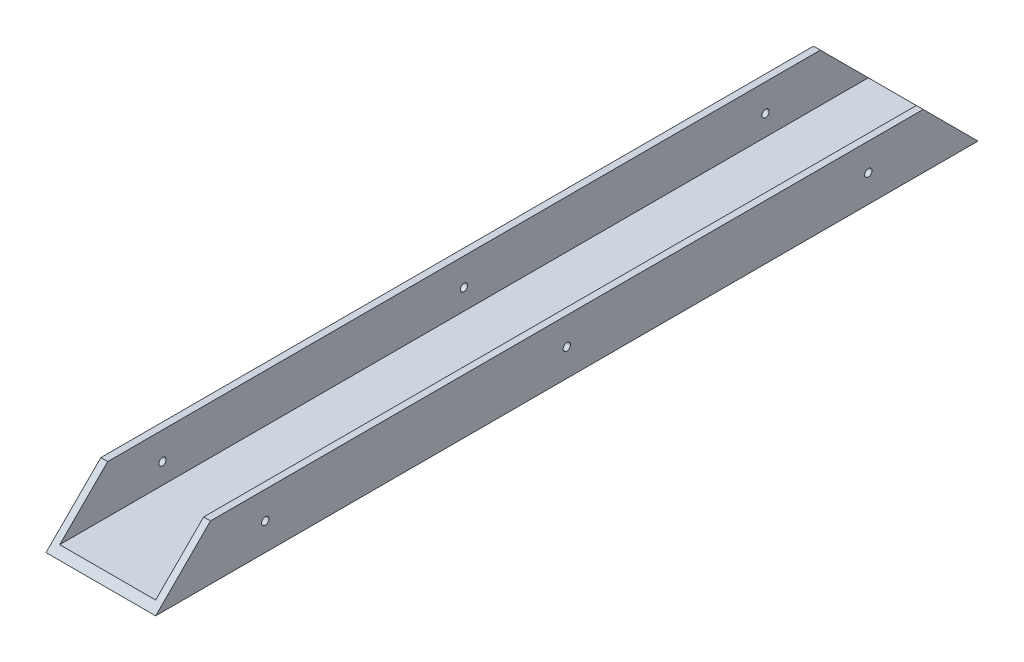
from build123d import *

# Parameters (mm, degrees)
BOSS_EXTRUDE1_DEPTH  = 381
CUT_EXTRUDE1_DEPTH   = 386.210072558
M3_CLEARANCE_HOLE1_D = 3.4


with BuildPart() as part:
    # Sketch1 → Boss-Extrude1 (new body)
    with BuildSketch(Plane.XY):
        Polygon((-25.4, 0), (25.4, 0), (25.4, 25.4), (22.225, 25.4), (22.225, 3.175), (-22.225, 3.175), (-22.225, 25.4), (-25.4, 25.4), align=None)
    extrude(amount=BOSS_EXTRUDE1_DEPTH)

    # Sketch2 → Cut-Extrude1 (cut, through all)
    with BuildSketch(Plane(origin=(25.4, 0, 0), x_dir=(0, 0, -1), z_dir=(1, 0, 0))):
        Polygon((-381, 0), (-355.6, 25.4), (-381, 25.4), align=None)
        Polygon((0, 0), (0, 25.4), (-25.4, 25.4), align=None)
    extrude(amount=-CUT_EXTRUDE1_DEPTH, mode=Mode.SUBTRACT)

    # M3 Clearance Hole1 (through all)
    with Locations(Plane(origin=(-25.4, 12.7, 50.8), x_dir=(0, -1, 0), z_dir=(-1, 0, 0))):
        with Locations((0, 0), (0, 139.7), (0, 279.4)):
            Hole(M3_CLEARANCE_HOLE1_D / 2)


solid = part.part
